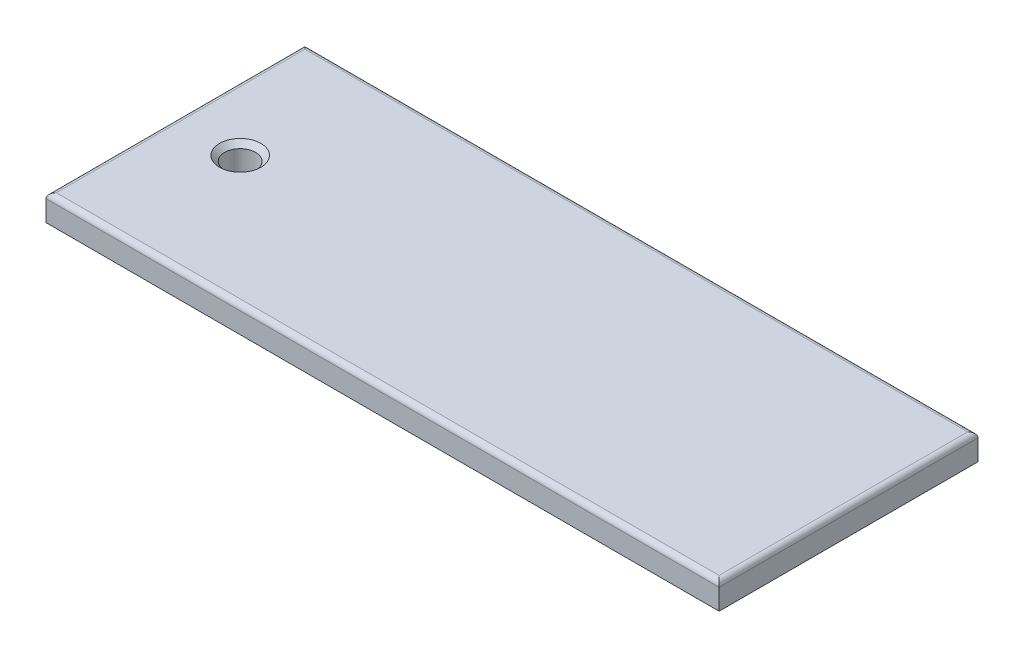
from build123d import *

# Parameters (mm, degrees)
SKETCH1_W           = 260
SKETCH1_H           = 100
BOSS_EXTRUDE1_DEPTH = 10
FILLET1_R           = 2
SKETCH2_R           = 6
CUT_EXTRUDE1_DEPTH  = 140.642400438
CHAMFER1_SIZE       = 2


with BuildPart() as part:
    # Sketch1 → Boss-Extrude1 (new body)
    with BuildSketch(Plane(origin=(0, 0, 0), x_dir=(1, 0, 0), z_dir=(0, 1, 0))):
        Rectangle(SKETCH1_W, SKETCH1_H)
    extrude(amount=BOSS_EXTRUDE1_DEPTH)

    # Fillet1
    fillet1_edges = [part.edges().sort_by_distance(p)[0] for p in [
        (-130, 10, 0),
        (0, 10, -50),
        (130, 10, 0),
        (0, 10, 50),
    ]]
    fillet(fillet1_edges, radius=FILLET1_R)

    # Sketch2 → Cut-Extrude1 (cut, through all)
    with BuildSketch(Plane(origin=(0, 10, 0), x_dir=(1, 0, 0), z_dir=(0, 1, 0))):
        with Locations((-105, 0)):
            Circle(SKETCH2_R)
    extrude(amount=-CUT_EXTRUDE1_DEPTH, mode=Mode.SUBTRACT)

    # Chamfer1
    chamfer1_edges = [part.edges().sort_by_distance(p)[0] for p in [
        (-111, 10, 0),
    ]]
    chamfer(chamfer1_edges, length=CHAMFER1_SIZE)


solid = part.part
